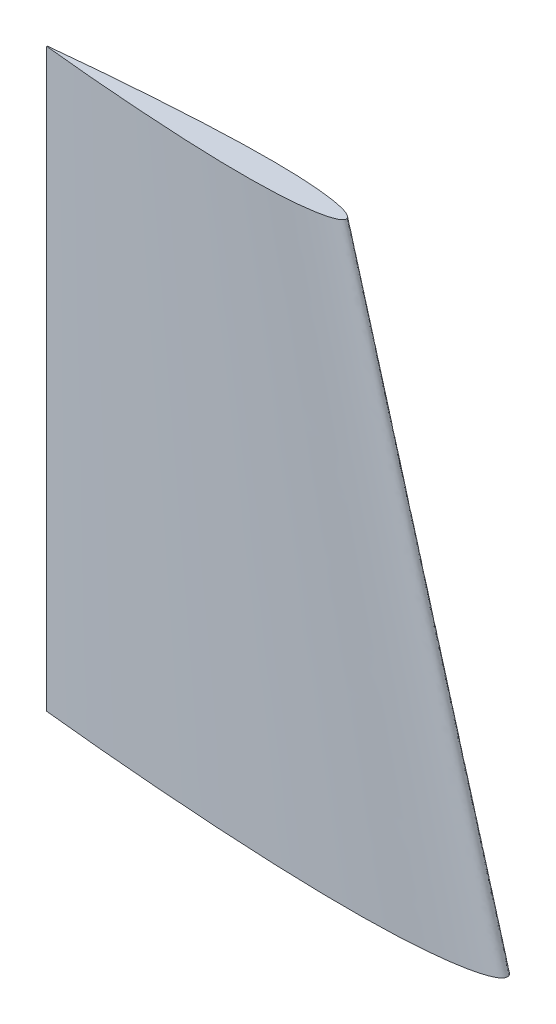
from build123d import *


with BuildPart() as part:
    # Sketch1 → Loft1 section 0
    with BuildSketch(Plane(origin=(0, 0, 0), x_dir=(1, 0, 0), z_dir=(0, 1, 0))):
        with BuildLine():
            Line((-150.36, 0.1420902), (-150.36, -0.1420902))
            add(Edge.make_bspline(
                [(-150.36, 0.1420902), (-150.222719656, 0.156521326), (-149.675132319, 0.214084572), (-148.448690293, 0.342023583), (-146.419551433, 0.550968849), (-143.609923022, 0.834626532), (-140.050576093, 1.184956248), (-135.780492958, 1.592473682), (-130.846451003, 2.046794833), (-125.30250783, 2.536978127), (-119.209409155, 3.051764655), (-112.633920337, 3.579642707), (-105.648091344, 4.108775411), (-98.328463102, 4.626839474), (-90.755224715, 5.120856311), (-83.011331416, 5.577104147), (-75.181593663, 5.981192639), (-67.351748009, 6.318356177), (-59.607519952, 6.573983889), (-52.033688711, 6.734357931), (-44.713160374, 6.787530262), (-37.726061567, 6.724221543), (-31.148837167, 6.538646042), (-25.053422625, 6.22903395), (-19.506247623, 5.798103847), (-14.567811834, 5.252290266), (-10.29028776, 4.603390963), (-6.720371997, 3.861508544), (-3.884199495, 3.052140492), (-1.812113831, 2.163512902), (-0.431729455, 1.245447929), (0.178488767, 0), (-0.431729455, -1.245447929), (-1.812113831, -2.163512902), (-3.884199495, -3.052140492), (-6.720371997, -3.861508544), (-10.29028776, -4.603390963), (-14.567811834, -5.252290266), (-19.506247623, -5.798103847), (-25.053422625, -6.22903395), (-31.148837167, -6.538646042), (-37.726061567, -6.724221543), (-44.713160374, -6.787530262), (-52.033688711, -6.734357931), (-59.607519952, -6.573983889), (-67.351748009, -6.318356177), (-75.181593663, -5.981192639), (-83.011331416, -5.577104147), (-90.755224715, -5.120856311), (-98.328463102, -4.626839474), (-105.648091344, -4.108775411), (-112.633920337, -3.579642707), (-119.209409155, -3.051764655), (-125.30250783, -2.536978127), (-130.846451003, -2.046794833), (-135.780492958, -1.592473682), (-140.050576093, -1.184956248), (-143.609923022, -0.834626532), (-146.419551433, -0.550968849), (-148.448690293, -0.342023583), (-149.675132319, -0.214084572), (-150.222719656, -0.156521326), (-150.36, -0.1420902)],
                knots=[0, 0, 0, 0, 0.001360811, 0.005428038, 0.012156267, 0.021470482, 0.03326704, 0.047414968, 0.063757539, 0.082114088, 0.102282038, 0.12403911, 0.147145729, 0.171347612, 0.196378555, 0.221963406, 0.247821218, 0.273668571, 0.299222988, 0.324206394, 0.348348543, 0.371390297, 0.393086736, 0.413210068, 0.431552463, 0.44792908, 0.462181893, 0.474185722, 0.483860131, 0.491198837, 0.496361358, 0.5, 0.503638642, 0.508801163, 0.516139869, 0.525814278, 0.537818107, 0.55207092, 0.568447537, 0.586789932, 0.606913264, 0.628609703, 0.651651457, 0.675793606, 0.700777012, 0.726331429, 0.752178782, 0.778036594, 0.803621445, 0.828652388, 0.852854271, 0.87596089, 0.897717962, 0.917885912, 0.936242461, 0.952585032, 0.96673296, 0.978529518, 0.987843733, 0.994571962, 0.998639189, 1, 1, 1, 1], degree=3))
        make_face()
    # Sketch2 → Loft1 section 1
    with BuildSketch(Plane(origin=(0, 187.95, 0), x_dir=(1, 0, 0), z_dir=(0, 1, 0))):
        with BuildLine():
            Line((-150.36, 0.09235863), (-150.36, -0.09235863))
            add(Edge.make_bspline(
                [(-150.36, 0.09235863), (-150.270767776, 0.101738862), (-149.914836008, 0.139154972), (-149.11764869, 0.222315329), (-147.798708431, 0.358129752), (-145.972449964, 0.542507246), (-143.65887446, 0.770221561), (-140.883320422, 1.035107893), (-137.676193152, 1.330416641), (-134.07263009, 1.649035782), (-130.112115951, 1.983647026), (-125.838048219, 2.32676776), (-121.297259374, 2.670704017), (-116.539501017, 3.007445658), (-111.616896065, 3.328556602), (-106.58336542, 3.625117696), (-101.494035881, 3.887775215), (-96.404636206, 4.106931515), (-91.370887969, 4.273089528), (-86.447897662, 4.377332655), (-81.689554243, 4.41189467), (-77.147940019, 4.370744003), (-72.872744158, 4.250119927), (-68.910724706, 4.048872068), (-65.305060955, 3.768767501), (-62.095077692, 3.413988673), (-59.314687044, 2.992204126), (-56.994241798, 2.509980554), (-55.150729672, 1.98389132), (-53.80387399, 1.406283386), (-52.906624146, 0.809541154), (-52.509982301, 0), (-52.906624146, -0.809541154), (-53.80387399, -1.406283386), (-55.150729672, -1.98389132), (-56.994241798, -2.509980554), (-59.314687044, -2.992204126), (-62.095077692, -3.413988673), (-65.305060955, -3.768767501), (-68.910724706, -4.048872068), (-72.872744158, -4.250119927), (-77.147940019, -4.370744003), (-81.689554243, -4.41189467), (-86.447897662, -4.377332655), (-91.370887969, -4.273089528), (-96.404636206, -4.106931515), (-101.494035881, -3.887775215), (-106.58336542, -3.625117696), (-111.616896065, -3.328556602), (-116.539501017, -3.007445658), (-121.297259374, -2.670704017), (-125.838048219, -2.32676776), (-130.112115951, -1.983647026), (-134.07263009, -1.649035782), (-137.676193152, -1.330416641), (-140.883320422, -1.035107893), (-143.65887446, -0.770221561), (-145.972449964, -0.542507246), (-147.798708431, -0.358129752), (-149.11764869, -0.222315329), (-149.914836008, -0.139154972), (-150.270767776, -0.101738862), (-150.36, -0.09235863)],
                knots=[0, 0, 0, 0, 0.001360811, 0.005428038, 0.012156267, 0.021470482, 0.03326704, 0.047414968, 0.063757539, 0.082114088, 0.102282038, 0.12403911, 0.147145729, 0.171347612, 0.196378555, 0.221963406, 0.247821218, 0.273668571, 0.299222988, 0.324206394, 0.348348543, 0.371390297, 0.393086736, 0.413210068, 0.431552463, 0.44792908, 0.462181893, 0.474185722, 0.483860131, 0.491198837, 0.496361358, 0.5, 0.503638642, 0.508801163, 0.516139869, 0.525814278, 0.537818107, 0.55207092, 0.568447537, 0.586789932, 0.606913264, 0.628609703, 0.651651457, 0.675793606, 0.700777012, 0.726331429, 0.752178782, 0.778036594, 0.803621445, 0.828652388, 0.852854271, 0.87596089, 0.897717962, 0.917885912, 0.936242461, 0.952585032, 0.96673296, 0.978529518, 0.987843733, 0.994571962, 0.998639189, 1, 1, 1, 1], degree=3))
        make_face()
    loft()


solid = part.part
